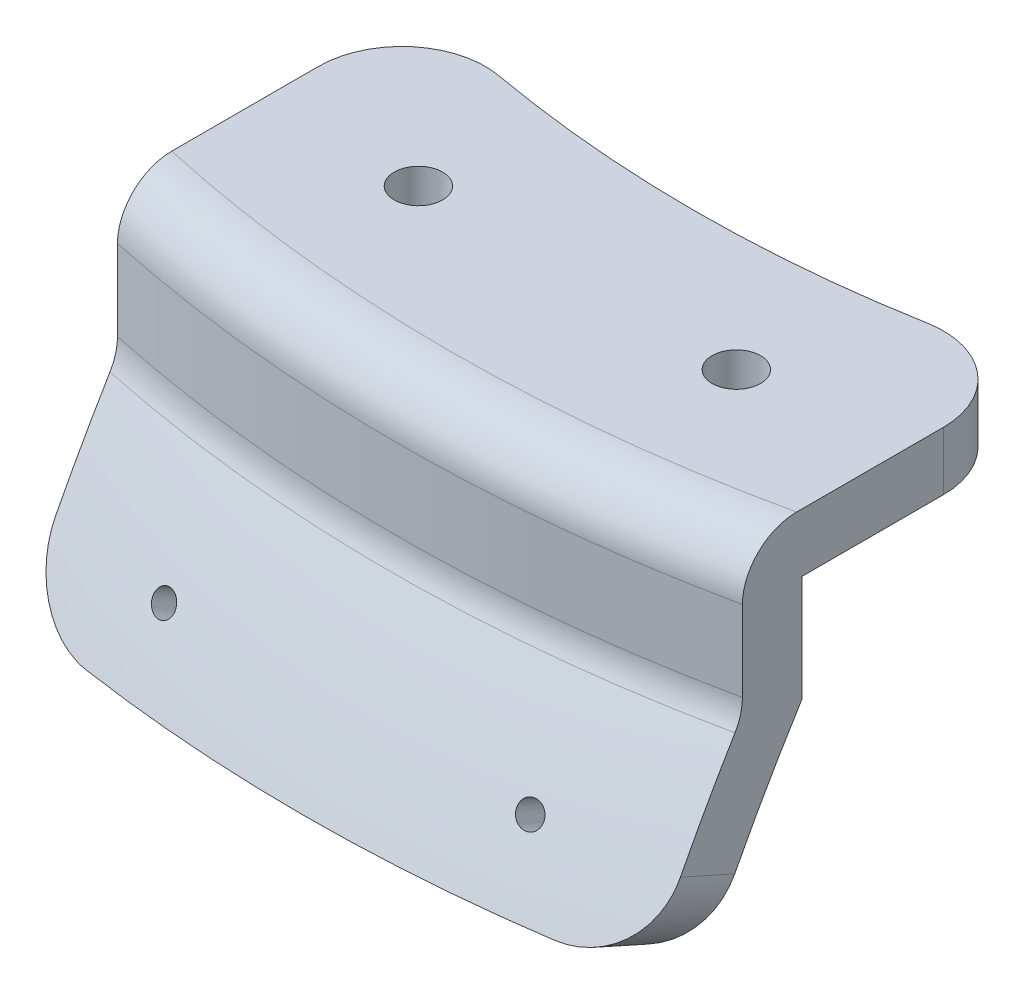
from build123d import *

# Parameters (mm, degrees)
REVOLVE1_ANGLE      = 30
FILLET1_R           = 6.35
SKETCH3_R           = 2.9
CUT_EXTRUDE1_DEPTH  = 203.322044441
SKETCH4_OUTSIDE_W   = 125.072
SKETCH4_OUTSIDE_H   = 77.706
SKETCH4_OUTSIDE_W_2 = 74.901446488
SKETCH4_OUTSIDE_H_2 = 51.793764091
CUT_EXTRUDE2_DEPTH  = 203.322044441
FILLET2_R           = 10


with BuildPart() as part:
    # Sketch2 → Revolve1 (revolve, symmetric)
    with BuildSketch(Plane(origin=(0, 0, 0), x_dir=(0, 0, -1), z_dir=(1, 0, 0))) as revolve1_sk:
        with BuildLine():
            Line((-173.273483179, 210.763736754), (-173.273483179, 198.063736754))
            ThreePointArc((-173.273483179, 198.063736754), (-179.58043611, 187.004513496), (-185.182449357, 175.572036864))
            Line((-185.182449357, 175.572036864), (-191.561766018, 178.453758388))
            ThreePointArc((-191.561766018, 178.453758388), (-186.230049964, 189.400075737), (-180.273483179, 200.019321082))
            Line((-180.273483179, 200.019321082), (-180.273483179, 217.763736754))
            Line((-180.273483179, 217.763736754), (-144.698483179, 217.763736754))
            Line((-144.698483179, 217.763736754), (-144.698483179, 210.763736754))
            Line((-144.698483179, 210.763736754), (-173.273483179, 210.763736754))
        make_face()
    revolve(axis=Axis((0, 91.919777778, 0), (0, 1, 0)), revolution_arc=REVOLVE1_ANGLE / 2)
    revolve(revolve1_sk.sketch, axis=Axis((0, 91.919777778, 0), (0, -1, 0)), revolution_arc=REVOLVE1_ANGLE / 2)

    # Fillet1
    fillet1_edges = [part.edges().sort_by_distance(p)[0] for p in [
        (0, 200.019321082, 180.273483179),
        (0, 217.763736754, 180.273483179),
    ]]
    fillet(fillet1_edges, radius=FILLET1_R)

    # Sketch3 → Cut-Extrude1 (cut, through all)
    with BuildSketch(Plane.XZ.offset(-217.763736754)):
        with Locations((19.05, 158.674245572)):
            Circle(SKETCH3_R)
        with Locations((-19.05, 158.674245572)):
            Circle(SKETCH3_R)
    extrude(amount=CUT_EXTRUDE1_DEPTH, mode=Mode.SUBTRACT)

    # Sketch4 outside → Cut-Extrude2 (cut, through all)
    with BuildSketch(Plane(origin=(0, 217.763736754, 0), x_dir=(1, 0, 0), z_dir=(0, 1, 0))):
        with Locations((0, -165.665)):
            Rectangle(SKETCH4_OUTSIDE_W, SKETCH4_OUTSIDE_H)
        with Locations((0, -165.664883973)):
            Rectangle(SKETCH4_OUTSIDE_W_2, SKETCH4_OUTSIDE_H_2, mode=Mode.SUBTRACT)
    extrude(amount=-CUT_EXTRUDE2_DEPTH, mode=Mode.SUBTRACT)

    # Fillet2
    fillet2_edges = [part.edges().sort_by_distance(p)[0] for p in [
        (-37.450723244, 177.012477742, 184.61079085),
        (-37.450723244, 214.263736754, 139.768001927),
        (37.450723244, 214.263736754, 139.768001927),
        (37.450723244, 177.012477742, 184.61079085),
    ]]
    fillet(fillet2_edges, radius=FILLET2_R)

    # Sketch6 → Cut-Revolve1 (revolve, cut)
    with BuildSketch(Plane(origin=(0, 72.974433775, -37.182331171), x_dir=(0, 0.4539904997395446, 0.891006524188369), z_dir=(0, 0.8910065241883691, -0.45399049973954464))):
        Polygon((217.724333315, 19.048410939), (275.794196508, 24.128865661), (275.663462894, 25.623157708), (217.593599701, 20.542702986), align=None)
    cut_revolve1 = revolve(axis=Axis((19.048410939, 171.819212662, 156.811470288), (0.08715574274765923, 0.4522629288245559, 0.887615975361608)), mode=Mode.SUBTRACT)

    # Mirror1: Cut-Revolve1 across plane
    add(cut_revolve1.mirror(Plane(origin=(0, 0, 0), x_dir=(0, 0, 1), z_dir=(1, 0, 0))), mode=Mode.SUBTRACT)


solid = part.part
